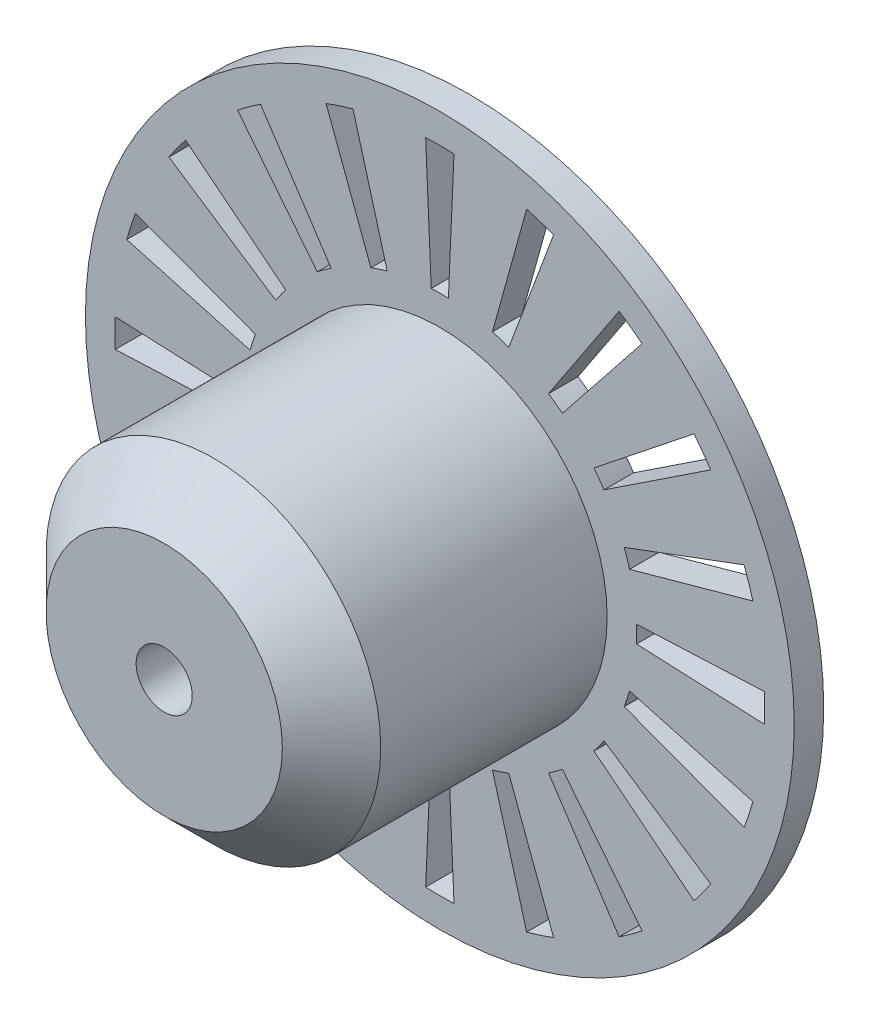
from build123d import *

# Parameters (mm, degrees)
ESBO_O1_R                = 18
RESSALTO_EXTRUS_O1_DEPTH = 1.5
ESBO_O3_R                = 8.5
RESSALTO_EXTRUS_O2_DEPTH = 14
ESBO_O4_W                = 1.6
ESBO_O4_H                = 3
RESSALTO_EXTRUS_O3_DEPTH = 1.5
CORTE_EXTRUS_O1_DEPTH    = 30.051678093
PADR_OCIRCULAR1_COUNT    = 20
ESBO_O7_R                = 1.425
CORTE_EXTRUS_O2_DEPTH    = 30.803523282
CHANFRO1_SIZE            = 2.5
ESBO_O8_R                = 1.925
CORTE_EXTRUS_O3_DEPTH    = 5.5
CHANFRO2_SIZE            = 0.5


with BuildPart() as part:
    # Esboço1 → Ressalto-extrusão1 (new body)
    with BuildSketch(Plane.XY):
        Circle(ESBO_O1_R)
    extrude(amount=RESSALTO_EXTRUS_O1_DEPTH)

    # Esboço3 → Ressalto-extrusão2 (add)
    with BuildSketch(Plane.XY.offset(1.5)):
        Circle(ESBO_O3_R)
    extrude(amount=RESSALTO_EXTRUS_O2_DEPTH)

    # Esboço4 → Ressalto-extrusão3 (add)
    with BuildSketch(Plane.XY.offset(1.5)):
        with Locations((0, 5.7)):
            Rectangle(ESBO_O4_W, ESBO_O4_H)
    extrude(amount=RESSALTO_EXTRUS_O3_DEPTH)

    # Esboço5 → Corte-extrusão1 (cut, through all)
    with BuildSketch(Plane.XY.offset(1.5)):
        with BuildLine():
            Line((-0.436193874, 9.990482216), (-0.719719892, 16.484295656))
            ThreePointArc((-0.719719892, 16.484295656), (0, 16.5), (0.719719892, 16.484295656))
            Line((0.719719892, 16.484295656), (0.436193874, 9.990482216))
            ThreePointArc((0.436193874, 9.990482216), (0, 10), (-0.436193874, 9.990482216))
        make_face()
    corte_extrus_o1 = extrude(amount=-CORTE_EXTRUS_O1_DEPTH, mode=Mode.SUBTRACT)

    # PadrãoCircular1: Corte-extrusão1 ×20 about axis
    padr_ocircular1_axis = Axis((0, 0, 1.5), (0, 0, -1))
    for i in range(1, PADR_OCIRCULAR1_COUNT):
        add(corte_extrus_o1.rotate(padr_ocircular1_axis, i * 360 / PADR_OCIRCULAR1_COUNT), mode=Mode.SUBTRACT)

    # Esboço7 → Corte-extrusão2 (cut, through all)
    with BuildSketch(Plane.XY.offset(15.5)):
        Circle(ESBO_O7_R)
    extrude(amount=-CORTE_EXTRUS_O2_DEPTH, mode=Mode.SUBTRACT)

    # Chanfro1
    chanfro1_edges = [part.edges().sort_by_distance(p)[0] for p in [
        (-8.5, 0, 15.5),
    ]]
    chamfer(chanfro1_edges, length=CHANFRO1_SIZE)

    # Esboço8 → Corte-extrusão3 (cut)
    with BuildSketch(Plane(origin=(0, 0, 0), x_dir=(-1, 0, 0), z_dir=(0, 0, -1))):
        Circle(ESBO_O8_R)
    extrude(amount=-CORTE_EXTRUS_O3_DEPTH, mode=Mode.SUBTRACT)

    # Chanfro2
    chanfro2_edges = [part.edges().sort_by_distance(p)[0] for p in [
        (1.925, 0, 0),
    ]]
    chamfer(chanfro2_edges, length=CHANFRO2_SIZE)


solid = part.part
